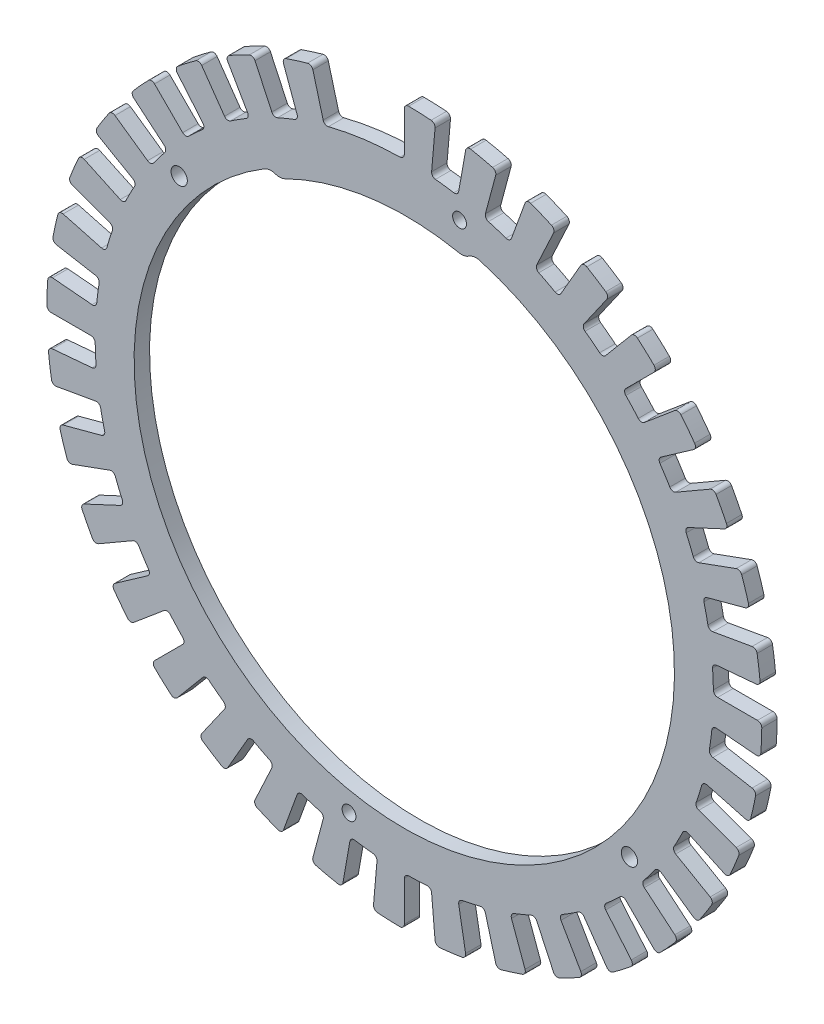
from build123d import *

# Parameters (mm, degrees)
SKETCH1_R           = 1.6
SKETCH1_R_2         = 1.88125
BOSS_EXTRUDE1_DEPTH = 3.571875


with BuildPart() as part:
    # Sketch1 → Boss-Extrude1 (new body)
    with BuildSketch(Plane.XY):
        with BuildLine():
            Line((7.120090774, 81.383009943), (6.318190247, 72.217244977))
            ThreePointArc((6.318190247, 72.217244977), (6.543925597, 71.492600102), (7.213496876, 71.135191451))
            ThreePointArc((7.213496876, 71.135191451), (9.332622744, 70.888307588), (11.443439394, 70.578308954))
            ThreePointArc((11.443439394, 70.578308954), (12.182699751, 70.750241401), (12.58829525, 71.391769993))
            Line((12.58829525, 71.391769993), (14.185993357, 80.45276622))
            ThreePointArc((14.185993357, 80.45276622), (14.60224868, 81.101765071), (15.35649023, 81.261726586))
            ThreePointArc((15.35649023, 81.261726586), (17.899556073, 80.739679789), (20.424982959, 80.138068801))
            ThreePointArc((20.424982959, 80.138068801), (21.040955292, 79.674338181), (21.143931966, 78.910228368))
            Line((21.143931966, 78.910228368), (18.762595726, 70.022960532))
            ThreePointArc((18.762595726, 70.022960532), (18.859068387, 69.270126109), (19.456404014, 68.801877466))
            ThreePointArc((19.456404014, 68.801877466), (21.500464665, 68.190761978), (23.525382569, 67.518933456))
            ThreePointArc((23.525382569, 67.518933456), (24.283267656, 67.559882649), (24.794101519, 68.12123406))
            Line((24.794101519, 68.12123406), (27.940952485, 76.76713603))
            ThreePointArc((27.940952485, 76.76713603), (28.463581422, 77.333993152), (29.234141374, 77.360551822))
            ThreePointArc((29.234141374, 77.360551822), (31.647919857, 76.404837339), (34.030511182, 75.373830397))
            ThreePointArc((34.030511182, 75.373830397), (34.556599534, 74.810182414), (34.525325484, 74.039799434))
            Line((34.525325484, 74.039799434), (30.636909229, 65.701063864))
            ThreePointArc((30.636909229, 65.701063864), (30.601187928, 64.942914386), (31.108138161, 64.378053249))
            ThreePointArc((31.108138161, 64.378053249), (33.015025846, 63.421274572), (34.892518899, 62.40802933))
            ThreePointArc((34.892518899, 62.40802933), (35.646000762, 62.316751049), (36.24655156, 62.780868901))
            Line((36.24655156, 62.780868901), (40.84693991, 70.748975258))
            ThreePointArc((40.84693991, 70.748975258), (41.460062645, 71.216466984), (42.223527925, 71.108815836))
            ThreePointArc((42.223527925, 71.108815836), (44.43467761, 69.748472569), (46.602039543, 68.319396297))
            ThreePointArc((46.602039543, 68.319396297), (47.022258986, 67.67295711), (46.857684459, 66.91970866))
            Line((46.857684459, 66.91970866), (41.580335748, 59.382873618))
            ThreePointArc((41.580335748, 59.382873618), (41.413505858, 58.642445073), (41.814667271, 57.998134462))
            ThreePointArc((41.814667271, 57.998134462), (43.526442174, 56.724763831), (45.199463699, 55.400888814))
            ThreePointArc((45.199463699, 55.400888814), (45.925648172, 55.180156502), (46.597668473, 55.53293881))
            Line((46.597668473, 55.53293881), (52.511813735, 62.581142673))
            ThreePointArc((52.511813735, 62.581142673), (53.196800845, 62.935064503), (53.929973946, 62.696474464))
            ThreePointArc((53.929973946, 62.696474464), (55.87131017, 60.972835754), (57.757588515, 59.189111912))
            ThreePointArc((57.757588515, 59.189111912), (58.059170893, 58.479523249), (57.766296402, 57.766296402))
            Line((57.766296402, 57.766296402), (51.260364806, 51.260364806))
            ThreePointArc((51.260364806, 51.260364806), (50.967495369, 50.56015474), (51.250678875, 49.855971707))
            ThreePointArc((51.250678875, 49.855971707), (52.715329582, 48.304699845), (54.133045666, 46.710420325))
            ThreePointArc((54.133045666, 46.710420325), (54.809868002, 46.366940822), (55.53293881, 46.597668473))
            Line((55.53293881, 46.597668473), (62.581142673, 52.511813735))
            ThreePointArc((62.581142673, 52.511813735), (63.31718117, 52.741411935), (63.997784998, 52.379132441))
            ThreePointArc((63.997784998, 52.379132441), (65.610321242, 50.344570179), (67.158202386, 48.260396313))
            ThreePointArc((67.158202386, 48.260396313), (67.331984272, 47.509218665), (66.91970866, 46.857684459))
            Line((66.91970866, 46.857684459), (59.382873618, 41.580335748))
            ThreePointArc((59.382873618, 41.580335748), (58.972863325, 40.94161969), (59.129464536, 40.19896048))
            ThreePointArc((59.129464536, 40.19896048), (60.302488376, 38.416921997), (61.421822434, 36.600679351))
            ThreePointArc((61.421822434, 36.600679351), (62.028717727, 36.144889108), (62.780868901, 36.24655156))
            Line((62.780868901, 36.24655156), (70.748975258, 40.84693991))
            ThreePointArc((70.748975258, 40.84693991), (71.513700985, 40.945238253), (72.121055738, 40.470276985))
            ThreePointArc((72.121055738, 40.470276985), (73.355795904, 38.186610315), (74.518248261, 35.865312993))
            ThreePointArc((74.518248261, 35.865312993), (74.55894938, 35.095370514), (74.039799434, 34.525325484))
            Line((74.039799434, 34.525325484), (65.701063864, 30.636909229))
            ThreePointArc((65.701063864, 30.636909229), (65.186370669, 30.079094244), (65.211631338, 29.320524181))
            ThreePointArc((65.211631338, 29.320524181), (66.057386575, 27.361865414), (66.844328207, 25.378845255))
            ThreePointArc((66.844328207, 25.378845255), (67.362856253, 24.824593229), (68.12123406, 24.794101519))
            Line((68.12123406, 24.794101519), (76.76713603, 27.940952485))
            ThreePointArc((76.76713603, 27.940952485), (77.537313183, 27.904964226), (78.052964694, 27.331752641))
            ThreePointArc((78.052964694, 27.331752641), (78.872391827, 24.868369619), (79.614094871, 22.380480286))
            ThreePointArc((79.614094871, 22.380480286), (79.52047854, 21.615167288), (78.910228368, 21.143931966))
            Line((78.910228368, 21.143931966), (70.022960532, 18.762595726))
            ThreePointArc((70.022960532, 18.762595726), (69.419223127, 18.30263074), (69.312375721, 17.551198591))
            ThreePointArc((69.312375721, 17.551198591), (69.805164509, 15.475432397), (70.235802893, 13.385887789))
            ThreePointArc((70.235802893, 13.385887789), (70.650208479, 12.750014647), (71.391769993, 12.58829525))
            Line((71.391769993, 12.58829525), (80.45276622, 14.185993357))
            ThreePointArc((80.45276622, 14.185993357), (81.204993357, 14.016811982), (81.613273815, 13.362766823))
            ThreePointArc((81.613273815, 13.362766823), (81.992490036, 10.794516097), (82.290907495, 8.215628011))
            ThreePointArc((82.290907495, 8.215628011), (82.065818199, 7.478198142), (81.383009943, 7.120090774))
            Line((81.383009943, 7.120090774), (72.217244977, 6.318190247))
            ThreePointArc((72.217244977, 6.318190247), (71.542807618, 5.970051062), (71.30709864, 5.248588713))
            ThreePointArc((71.30709864, 5.248588713), (71.431947843, 3.118786197), (71.49319825, 0.986206897))
            ThreePointArc((71.49319825, 0.986206897), (71.79088987, 0.288033321), (72.49310312, 0))
            Line((72.49310312, 0), (81.69387982, 0))
            ThreePointArc((81.69387982, 0), (82.405300898, -0.297234001), (82.693804909, -1.012239902))
            ThreePointArc((82.693804909, -1.012239902), (82.621287925, -3.607323335), (82.467352536, -6.198851964))
            ThreePointArc((82.467352536, -6.198851964), (82.1176295, -6.88599227), (81.383009943, -7.120090774))
            Line((81.383009943, -7.120090774), (72.217244977, -6.318190247))
            ThreePointArc((72.217244977, -6.318190247), (71.492600102, -6.543925597), (71.135191451, -7.213496876))
            ThreePointArc((71.135191451, -7.213496876), (70.888307588, -9.332622744), (70.578308954, -11.443439394))
            ThreePointArc((70.578308954, -11.443439394), (70.750241401, -12.182699751), (71.391769993, -12.58829525))
            Line((71.391769993, -12.58829525), (80.45276622, -14.185993357))
            ThreePointArc((80.45276622, -14.185993357), (81.101765071, -14.60224868), (81.261726586, -15.35649023))
            ThreePointArc((81.261726586, -15.35649023), (80.739679789, -17.899556073), (80.138068801, -20.424982959))
            ThreePointArc((80.138068801, -20.424982959), (79.674338181, -21.040955292), (78.910228368, -21.143931966))
            Line((78.910228368, -21.143931966), (70.022960532, -18.762595726))
            ThreePointArc((70.022960532, -18.762595726), (69.270126109, -18.859068387), (68.801877466, -19.456404014))
            ThreePointArc((68.801877466, -19.456404014), (68.190761979, -21.500464665), (67.518933456, -23.525382569))
            ThreePointArc((67.518933456, -23.525382569), (67.559882649, -24.283267656), (68.12123406, -24.794101519))
            Line((68.12123406, -24.794101519), (76.76713603, -27.940952485))
            ThreePointArc((76.76713603, -27.940952485), (77.333993152, -28.463581422), (77.360551822, -29.234141374))
            ThreePointArc((77.360551822, -29.234141374), (76.404837339, -31.647919857), (75.373830397, -34.030511182))
            ThreePointArc((75.373830397, -34.030511182), (74.810182414, -34.556599534), (74.039799434, -34.525325484))
            Line((74.039799434, -34.525325484), (65.701063864, -30.636909229))
            ThreePointArc((65.701063864, -30.636909229), (64.942914386, -30.601187928), (64.378053249, -31.10813816))
            ThreePointArc((64.378053249, -31.10813816), (63.421274572, -33.015025846), (62.40802933, -34.892518899))
            ThreePointArc((62.40802933, -34.892518899), (62.316751049, -35.646000762), (62.780868901, -36.24655156))
            Line((62.780868901, -36.24655156), (70.748975258, -40.84693991))
            ThreePointArc((70.748975258, -40.84693991), (71.216466984, -41.460062645), (71.108815836, -42.223527925))
            ThreePointArc((71.108815836, -42.223527925), (69.748472569, -44.43467761), (68.319396297, -46.602039543))
            ThreePointArc((68.319396297, -46.602039543), (67.67295711, -47.022258986), (66.91970866, -46.857684459))
            Line((66.91970866, -46.857684459), (59.382873618, -41.580335748))
            ThreePointArc((59.382873618, -41.580335748), (58.642445073, -41.413505858), (57.998134462, -41.814667271))
            ThreePointArc((57.998134462, -41.814667271), (56.724763831, -43.526442174), (55.400888814, -45.199463699))
            ThreePointArc((55.400888814, -45.199463699), (55.180156502, -45.925648172), (55.53293881, -46.597668473))
            Line((55.53293881, -46.597668473), (62.581142673, -52.511813735))
            ThreePointArc((62.581142673, -52.511813735), (62.935064503, -53.196800845), (62.696474464, -53.929973946))
            ThreePointArc((62.696474464, -53.929973946), (60.972835754, -55.87131017), (59.189111912, -57.757588515))
            ThreePointArc((59.189111912, -57.757588515), (58.479523249, -58.059170893), (57.766296402, -57.766296402))
            Line((57.766296402, -57.766296402), (51.260364806, -51.260364806))
            ThreePointArc((51.260364806, -51.260364806), (50.56015474, -50.967495369), (49.855971707, -51.250678875))
            ThreePointArc((49.855971707, -51.250678875), (48.304699845, -52.715329582), (46.710420325, -54.133045666))
            ThreePointArc((46.710420325, -54.133045666), (46.366940822, -54.809868002), (46.597668473, -55.53293881))
            Line((46.597668473, -55.53293881), (52.511813735, -62.581142673))
            ThreePointArc((52.511813735, -62.581142673), (52.741411935, -63.31718117), (52.379132441, -63.997784998))
            ThreePointArc((52.379132441, -63.997784998), (50.344570179, -65.610321242), (48.260396313, -67.158202386))
            ThreePointArc((48.260396313, -67.158202386), (47.509218665, -67.331984272), (46.857684459, -66.91970866))
            Line((46.857684459, -66.91970866), (41.580335748, -59.382873618))
            ThreePointArc((41.580335748, -59.382873618), (40.94161969, -58.972863325), (40.19896048, -59.129464536))
            ThreePointArc((40.19896048, -59.129464536), (38.416921997, -60.302488376), (36.600679351, -61.421822434))
            ThreePointArc((36.600679351, -61.421822434), (36.144889108, -62.028717727), (36.24655156, -62.780868901))
            Line((36.24655156, -62.780868901), (40.84693991, -70.748975258))
            ThreePointArc((40.84693991, -70.748975258), (40.945238253, -71.513700985), (40.470276985, -72.121055738))
            ThreePointArc((40.470276985, -72.121055738), (38.186610315, -73.355795904), (35.865312993, -74.518248261))
            ThreePointArc((35.865312993, -74.518248261), (35.095370514, -74.55894938), (34.525325484, -74.039799434))
            Line((34.525325484, -74.039799434), (30.636909229, -65.701063864))
            ThreePointArc((30.636909229, -65.701063864), (30.079094244, -65.186370669), (29.320524181, -65.211631338))
            ThreePointArc((29.320524181, -65.211631338), (27.361865414, -66.057386575), (25.378845255, -66.844328207))
            ThreePointArc((25.378845255, -66.844328207), (24.824593229, -67.362856253), (24.794101519, -68.12123406))
            Line((24.794101519, -68.12123406), (27.940952485, -76.76713603))
            ThreePointArc((27.940952485, -76.76713603), (27.904964226, -77.537313183), (27.331752641, -78.052964694))
            ThreePointArc((27.331752641, -78.052964694), (24.868369619, -78.872391827), (22.380480286, -79.614094871))
            ThreePointArc((22.380480286, -79.614094871), (21.615167288, -79.52047854), (21.143931966, -78.910228368))
            Line((21.143931966, -78.910228368), (18.762595726, -70.022960532))
            ThreePointArc((18.762595726, -70.022960532), (18.30263074, -69.419223127), (17.551198591, -69.312375721))
            ThreePointArc((17.551198591, -69.312375721), (15.475432397, -69.805164509), (13.385887789, -70.235802893))
            ThreePointArc((13.385887789, -70.235802893), (12.750014647, -70.650208479), (12.58829525, -71.391769993))
            Line((12.58829525, -71.391769993), (14.185993357, -80.45276622))
            ThreePointArc((14.185993357, -80.45276622), (14.016811982, -81.204993357), (13.362766823, -81.613273815))
            ThreePointArc((13.362766823, -81.613273815), (10.794516097, -81.992490036), (8.215628011, -82.290907495))
            ThreePointArc((8.215628011, -82.290907495), (7.478198142, -82.065818199), (7.120090774, -81.383009943))
            Line((7.120090774, -81.383009943), (6.318190247, -72.217244977))
            ThreePointArc((6.318190247, -72.217244977), (5.970051062, -71.542807618), (5.248588713, -71.30709864))
            ThreePointArc((5.248588713, -71.30709864), (3.118786197, -71.431947843), (0.986206897, -71.49319825))
            ThreePointArc((0.986206897, -71.49319825), (0.288033321, -71.79088987), (0, -72.49310312))
            Line((0, -72.49310312), (0, -81.69387982))
            ThreePointArc((0, -81.69387982), (-0.297234001, -82.405300898), (-1.012239902, -82.693804909))
            ThreePointArc((-1.012239902, -82.693804909), (-3.607323335, -82.621287925), (-6.198851964, -82.467352536))
            ThreePointArc((-6.198851964, -82.467352536), (-6.88599227, -82.1176295), (-7.120090774, -81.383009943))
            Line((-7.120090774, -81.383009943), (-6.318190247, -72.217244977))
            ThreePointArc((-6.318190247, -72.217244977), (-6.543925597, -71.492600102), (-7.213496876, -71.135191451))
            ThreePointArc((-7.213496876, -71.135191451), (-9.332622744, -70.888307588), (-11.443439394, -70.578308954))
            ThreePointArc((-11.443439394, -70.578308954), (-12.182699751, -70.750241401), (-12.58829525, -71.391769993))
            Line((-12.58829525, -71.391769993), (-14.185993357, -80.45276622))
            ThreePointArc((-14.185993357, -80.45276622), (-14.60224868, -81.101765071), (-15.35649023, -81.261726586))
            ThreePointArc((-15.35649023, -81.261726586), (-17.899556073, -80.739679789), (-20.424982959, -80.138068801))
            ThreePointArc((-20.424982959, -80.138068801), (-21.040955292, -79.674338181), (-21.143931966, -78.910228368))
            Line((-21.143931966, -78.910228368), (-18.762595726, -70.022960532))
            ThreePointArc((-18.762595726, -70.022960532), (-18.859068387, -69.270126109), (-19.456404014, -68.801877466))
            ThreePointArc((-19.456404014, -68.801877466), (-21.500464665, -68.190761979), (-23.525382569, -67.518933456))
            ThreePointArc((-23.525382569, -67.518933456), (-24.283267656, -67.559882649), (-24.794101519, -68.12123406))
            Line((-24.794101519, -68.12123406), (-27.940952485, -76.76713603))
            ThreePointArc((-27.940952485, -76.76713603), (-28.463581422, -77.333993152), (-29.234141374, -77.360551822))
            ThreePointArc((-29.234141374, -77.360551822), (-31.647919857, -76.404837339), (-34.030511182, -75.373830397))
            ThreePointArc((-34.030511182, -75.373830397), (-34.556599534, -74.810182414), (-34.525325484, -74.039799434))
            Line((-34.525325484, -74.039799434), (-30.636909229, -65.701063864))
            ThreePointArc((-30.636909229, -65.701063864), (-30.601187928, -64.942914386), (-31.10813816, -64.378053249))
            ThreePointArc((-31.10813816, -64.378053249), (-33.015025846, -63.421274572), (-34.892518899, -62.40802933))
            ThreePointArc((-34.892518899, -62.40802933), (-35.646000762, -62.316751049), (-36.24655156, -62.780868901))
            Line((-36.24655156, -62.780868901), (-40.84693991, -70.748975258))
            ThreePointArc((-40.84693991, -70.748975258), (-41.460062645, -71.216466984), (-42.223527925, -71.108815836))
            ThreePointArc((-42.223527925, -71.108815836), (-44.43467761, -69.748472569), (-46.602039543, -68.319396297))
            ThreePointArc((-46.602039543, -68.319396297), (-47.022258986, -67.67295711), (-46.857684459, -66.91970866))
            Line((-46.857684459, -66.91970866), (-41.580335748, -59.382873618))
            ThreePointArc((-41.580335748, -59.382873618), (-41.413505858, -58.642445073), (-41.814667271, -57.998134462))
            ThreePointArc((-41.814667271, -57.998134462), (-43.526442174, -56.724763831), (-45.199463699, -55.400888814))
            ThreePointArc((-45.199463699, -55.400888814), (-45.925648172, -55.180156502), (-46.597668473, -55.53293881))
            Line((-46.597668473, -55.53293881), (-52.511813735, -62.581142673))
            ThreePointArc((-52.511813735, -62.581142673), (-53.196800845, -62.935064504), (-53.929973946, -62.696474464))
            ThreePointArc((-53.929973946, -62.696474464), (-55.87131017, -60.972835754), (-57.757588515, -59.189111912))
            ThreePointArc((-57.757588515, -59.189111912), (-58.059170893, -58.479523249), (-57.766296402, -57.766296402))
            Line((-57.766296402, -57.766296402), (-51.260364806, -51.260364806))
            ThreePointArc((-51.260364806, -51.260364806), (-50.967495369, -50.56015474), (-51.250678875, -49.855971707))
            ThreePointArc((-51.250678875, -49.855971707), (-52.715329582, -48.304699845), (-54.133045666, -46.710420325))
            ThreePointArc((-54.133045666, -46.710420325), (-54.809868002, -46.366940822), (-55.53293881, -46.597668473))
            Line((-55.53293881, -46.597668473), (-62.581142673, -52.511813735))
            ThreePointArc((-62.581142673, -52.511813735), (-63.31718117, -52.741411935), (-63.997784998, -52.379132441))
            ThreePointArc((-63.997784998, -52.379132441), (-65.610321242, -50.344570179), (-67.158202386, -48.260396313))
            ThreePointArc((-67.158202386, -48.260396313), (-67.331984272, -47.509218665), (-66.91970866, -46.857684459))
            Line((-66.91970866, -46.857684459), (-59.382873618, -41.580335748))
            ThreePointArc((-59.382873618, -41.580335748), (-58.972863325, -40.94161969), (-59.129464536, -40.19896048))
            ThreePointArc((-59.129464536, -40.19896048), (-60.302488376, -38.416921997), (-61.421822434, -36.600679351))
            ThreePointArc((-61.421822434, -36.600679351), (-62.028717727, -36.144889108), (-62.780868901, -36.24655156))
            Line((-62.780868901, -36.24655156), (-70.748975258, -40.84693991))
            ThreePointArc((-70.748975258, -40.84693991), (-71.513700985, -40.945238253), (-72.121055738, -40.470276985))
            ThreePointArc((-72.121055738, -40.470276985), (-73.355795904, -38.186610315), (-74.518248261, -35.865312993))
            ThreePointArc((-74.518248261, -35.865312993), (-74.55894938, -35.095370514), (-74.039799434, -34.525325484))
            Line((-74.039799434, -34.525325484), (-65.701063864, -30.636909229))
            ThreePointArc((-65.701063864, -30.636909229), (-65.186370669, -30.079094244), (-65.211631338, -29.320524181))
            ThreePointArc((-65.211631338, -29.320524181), (-66.057386575, -27.361865414), (-66.844328207, -25.378845255))
            ThreePointArc((-66.844328207, -25.378845255), (-67.362856253, -24.824593229), (-68.12123406, -24.794101519))
            Line((-68.12123406, -24.794101519), (-76.76713603, -27.940952485))
            ThreePointArc((-76.76713603, -27.940952485), (-77.537313183, -27.904964226), (-78.052964694, -27.331752641))
            ThreePointArc((-78.052964694, -27.331752641), (-78.872391827, -24.868369619), (-79.614094871, -22.380480286))
            ThreePointArc((-79.614094871, -22.380480286), (-79.52047854, -21.615167288), (-78.910228368, -21.143931966))
            Line((-78.910228368, -21.143931966), (-70.022960532, -18.762595726))
            ThreePointArc((-70.022960532, -18.762595726), (-69.419223127, -18.30263074), (-69.312375721, -17.551198591))
            ThreePointArc((-69.312375721, -17.551198591), (-69.805164509, -15.475432397), (-70.235802893, -13.385887789))
            ThreePointArc((-70.235802893, -13.385887789), (-70.650208479, -12.750014647), (-71.391769993, -12.58829525))
            Line((-71.391769993, -12.58829525), (-80.45276622, -14.185993357))
            ThreePointArc((-80.45276622, -14.185993357), (-81.204993357, -14.016811982), (-81.613273815, -13.362766823))
            ThreePointArc((-81.613273815, -13.362766823), (-81.992490036, -10.794516097), (-82.290907495, -8.215628011))
            ThreePointArc((-82.290907495, -8.215628011), (-82.065818199, -7.478198142), (-81.383009943, -7.120090774))
            Line((-81.383009943, -7.120090774), (-72.217244977, -6.318190247))
            ThreePointArc((-72.217244977, -6.318190247), (-71.542807618, -5.970051062), (-71.30709864, -5.248588713))
            ThreePointArc((-71.30709864, -5.248588713), (-71.431947843, -3.118786197), (-71.49319825, -0.986206897))
            ThreePointArc((-71.49319825, -0.986206897), (-71.79088987, -0.288033321), (-72.49310312, 0))
            Line((-72.49310312, 0), (-81.69387982, 0))
            ThreePointArc((-81.69387982, 0), (-82.405300898, 0.297234001), (-82.693804909, 1.012239902))
            ThreePointArc((-82.693804909, 1.012239902), (-82.621287925, 3.607323335), (-82.467352536, 6.198851964))
            ThreePointArc((-82.467352536, 6.198851964), (-82.1176295, 6.88599227), (-81.383009943, 7.120090774))
            Line((-81.383009943, 7.120090774), (-72.217244977, 6.318190247))
            ThreePointArc((-72.217244977, 6.318190247), (-71.492600102, 6.543925597), (-71.135191451, 7.213496876))
            ThreePointArc((-71.135191451, 7.213496876), (-70.888307588, 9.332622744), (-70.578308954, 11.443439394))
            ThreePointArc((-70.578308954, 11.443439394), (-70.750241401, 12.182699751), (-71.391769993, 12.58829525))
            Line((-71.391769993, 12.58829525), (-80.45276622, 14.185993357))
            ThreePointArc((-80.45276622, 14.185993357), (-81.101765071, 14.60224868), (-81.261726586, 15.35649023))
            ThreePointArc((-81.261726586, 15.35649023), (-80.739679789, 17.899556073), (-80.138068801, 20.424982959))
            ThreePointArc((-80.138068801, 20.424982959), (-79.674338181, 21.040955292), (-78.910228368, 21.143931966))
            Line((-78.910228368, 21.143931966), (-70.022960532, 18.762595726))
            ThreePointArc((-70.022960532, 18.762595726), (-69.270126109, 18.859068387), (-68.801877466, 19.456404014))
            ThreePointArc((-68.801877466, 19.456404014), (-68.190761979, 21.500464665), (-67.518933456, 23.525382569))
            ThreePointArc((-67.518933456, 23.525382569), (-67.559882649, 24.283267656), (-68.12123406, 24.794101519))
            Line((-68.12123406, 24.794101519), (-76.76713603, 27.940952485))
            ThreePointArc((-76.76713603, 27.940952485), (-77.333993152, 28.463581422), (-77.360551822, 29.234141374))
            ThreePointArc((-77.360551822, 29.234141374), (-76.404837339, 31.647919857), (-75.373830397, 34.030511182))
            ThreePointArc((-75.373830397, 34.030511182), (-74.810182414, 34.556599534), (-74.039799434, 34.525325484))
            Line((-74.039799434, 34.525325484), (-65.701063864, 30.636909229))
            ThreePointArc((-65.701063864, 30.636909229), (-64.942914386, 30.601187928), (-64.378053249, 31.10813816))
            ThreePointArc((-64.378053249, 31.10813816), (-63.421274572, 33.015025846), (-62.40802933, 34.892518899))
            ThreePointArc((-62.40802933, 34.892518899), (-62.316751049, 35.646000762), (-62.780868901, 36.24655156))
            Line((-62.780868901, 36.24655156), (-70.748975258, 40.84693991))
            ThreePointArc((-70.748975258, 40.84693991), (-71.216466984, 41.460062645), (-71.108815836, 42.223527925))
            ThreePointArc((-71.108815836, 42.223527925), (-69.748472569, 44.43467761), (-68.319396297, 46.602039543))
            ThreePointArc((-68.319396297, 46.602039543), (-67.67295711, 47.022258986), (-66.91970866, 46.857684459))
            Line((-66.91970866, 46.857684459), (-59.382873618, 41.580335748))
            ThreePointArc((-59.382873618, 41.580335748), (-58.642445073, 41.413505858), (-57.998134462, 41.814667271))
            ThreePointArc((-57.998134462, 41.814667271), (-56.724763831, 43.526442174), (-55.400888814, 45.199463699))
            ThreePointArc((-55.400888814, 45.199463699), (-55.180156502, 45.925648172), (-55.53293881, 46.597668473))
            Line((-55.53293881, 46.597668473), (-62.581142673, 52.511813735))
            ThreePointArc((-62.581142673, 52.511813735), (-62.935064504, 53.196800845), (-62.696474464, 53.929973946))
            ThreePointArc((-62.696474464, 53.929973946), (-60.972835754, 55.87131017), (-59.189111912, 57.757588515))
            ThreePointArc((-59.189111912, 57.757588515), (-58.479523249, 58.059170893), (-57.766296402, 57.766296402))
            Line((-57.766296402, 57.766296402), (-51.260364806, 51.260364806))
            ThreePointArc((-51.260364806, 51.260364806), (-50.56015474, 50.967495369), (-49.855971707, 51.250678875))
            ThreePointArc((-49.855971707, 51.250678875), (-48.304699845, 52.715329582), (-46.710420325, 54.133045666))
            ThreePointArc((-46.710420325, 54.133045666), (-46.366940822, 54.809868002), (-46.597668473, 55.53293881))
            Line((-46.597668473, 55.53293881), (-52.511813735, 62.581142673))
            ThreePointArc((-52.511813735, 62.581142673), (-52.741411935, 63.31718117), (-52.379132441, 63.997784998))
            ThreePointArc((-52.379132441, 63.997784998), (-50.344570179, 65.610321242), (-48.260396313, 67.158202386))
            ThreePointArc((-48.260396313, 67.158202386), (-47.509218665, 67.331984272), (-46.857684459, 66.91970866))
            Line((-46.857684459, 66.91970866), (-41.580335748, 59.382873618))
            ThreePointArc((-41.580335748, 59.382873618), (-40.94161969, 58.972863325), (-40.19896048, 59.129464536))
            ThreePointArc((-40.19896048, 59.129464536), (-38.416921997, 60.302488376), (-36.600679351, 61.421822434))
            ThreePointArc((-36.600679351, 61.421822434), (-36.144889108, 62.028717727), (-36.24655156, 62.780868901))
            Line((-36.24655156, 62.780868901), (-40.84693991, 70.748975258))
            ThreePointArc((-40.84693991, 70.748975258), (-40.945238253, 71.513700985), (-40.470276985, 72.121055738))
            ThreePointArc((-40.470276985, 72.121055738), (-38.186610315, 73.355795904), (-35.865312993, 74.518248261))
            ThreePointArc((-35.865312993, 74.518248261), (-35.095370514, 74.55894938), (-34.525325484, 74.039799434))
            Line((-34.525325484, 74.039799434), (-30.636909229, 65.701063864))
            ThreePointArc((-30.636909229, 65.701063864), (-30.079094244, 65.186370669), (-29.320524181, 65.211631338))
            ThreePointArc((-29.320524181, 65.211631338), (-27.361865414, 66.057386575), (-25.378845255, 66.844328207))
            ThreePointArc((-25.378845255, 66.844328207), (-24.824593229, 67.362856253), (-24.794101519, 68.12123406))
            Line((-24.794101519, 68.12123406), (-27.940952485, 76.76713603))
            ThreePointArc((-27.940952485, 76.76713603), (-27.904964226, 77.537313183), (-27.331752641, 78.052964694))
            ThreePointArc((-27.331752641, 78.052964694), (-24.868369619, 78.872391827), (-22.380480286, 79.614094871))
            ThreePointArc((-22.380480286, 79.614094871), (-21.615167288, 79.52047854), (-21.143931966, 78.910228368))
            Line((-21.143931966, 78.910228368), (-18.762595726, 70.022960532))
            ThreePointArc((-18.762595726, 70.022960532), (-18.30263074, 69.419223127), (-17.551198591, 69.312375721))
            ThreePointArc((-17.551198591, 69.312375721), (-15.475432397, 69.805164509), (-13.385887789, 70.235802893))
            ThreePointArc((-13.385887789, 70.235802893), (-7.213573177, 71.135183714), (-0.986360266, 71.493196134))
            ThreePointArc((-0.986360266, 71.493196134), (-0.288033321, 71.79088987), (0, 72.49310312))
            Line((0, 72.49310312), (0, 81.69387982))
            ThreePointArc((0, 81.69387982), (0.297234001, 82.405300898), (1.012239902, 82.693804909))
            ThreePointArc((1.012239902, 82.693804909), (3.607323335, 82.621287925), (6.198851964, 82.467352536))
            ThreePointArc((6.198851964, 82.467352536), (6.88599227, 82.1176295), (7.120090774, 81.383009943))
        make_face()
        with Locations((12.78420269, 65.769021291)):
            Circle(SKETCH1_R, mode=Mode.SUBTRACT)
        with Locations((-12.78420269, -65.769021291)):
            Circle(SKETCH1_R, mode=Mode.SUBTRACT)
        with Locations((52.068779418, -42.1644662)):
            Circle(SKETCH1_R_2, mode=Mode.SUBTRACT)
        with Locations((-52.068779418, 42.1644662)):
            Circle(SKETCH1_R_2, mode=Mode.SUBTRACT)
        with BuildLine():
            ThreePointArc((-32.399534916, 53.446423053), (8.157887014, -61.965303836), (17.462595357, 60.010897039))
            ThreePointArc((17.462595357, 60.010897039), (16.158723626, 60.09401264), (14.943172899, 59.61502817))
            ThreePointArc((14.943172899, 59.61502817), (13.835125402, 59.154945408), (12.635405963, 59.165839098))
            ThreePointArc((12.635405963, 59.165839098), (-7.879614623, 59.851615177), (-27.518110923, 53.879528313))
            ThreePointArc((-27.518110923, 53.879528313), (-28.674131419, 53.558495577), (-29.863501295, 53.716117604))
            ThreePointArc((-29.863501295, 53.716117604), (-31.161603438, 53.864173396), (-32.399534916, 53.446423053))
        make_face(mode=Mode.SUBTRACT)
    extrude(amount=BOSS_EXTRUDE1_DEPTH)


solid = part.part
